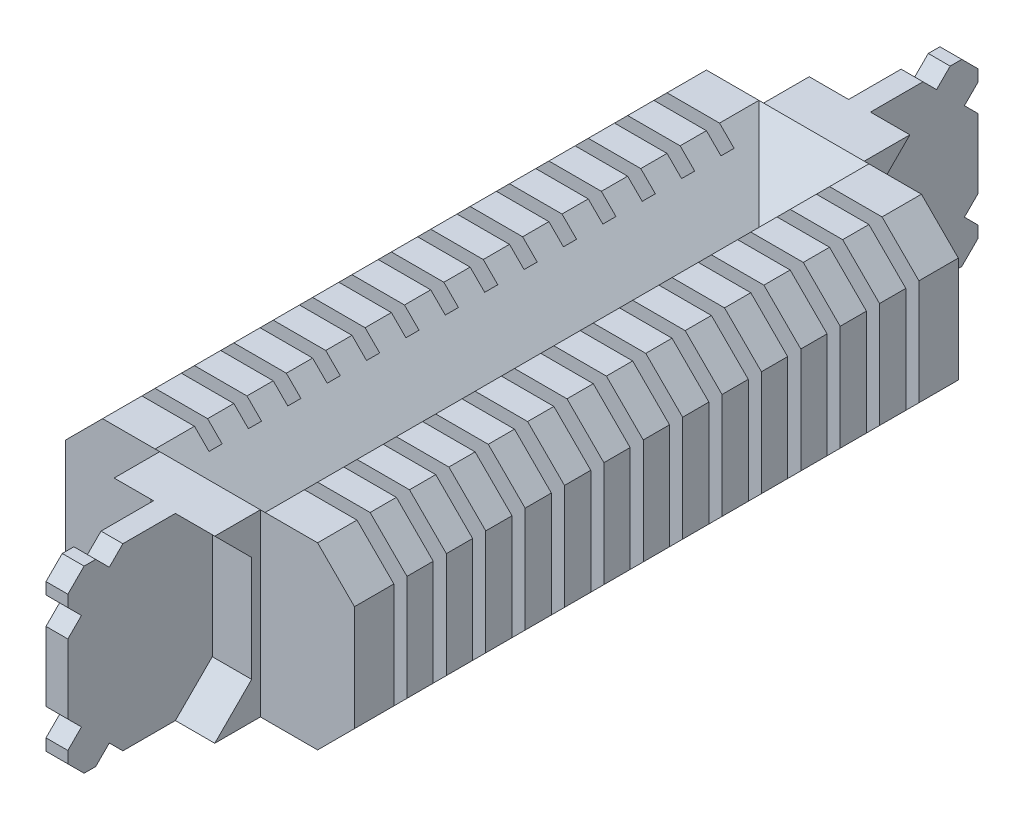
from build123d import *

# Parameters (mm, degrees)
AUFSATZ_LINEAR_AUSTRAGEN2_DEPTH      = 1.2
SCHNITT_LINEAR_AUSTRAGEN1_DEPTH      = 0.4
SCHNITT_LINEAR_AUSTRAGEN2_DEPTH      = 23.948638304
AUFSATZ_LINEAR_AUSTRAGEN3_DEPTH      = 1.2
SCHNITT_LINEAR_AUSTRAGEN3_DEPTH      = 24.198275798
LINEARES_MUSTER1_COUNT               = 15
LINEARES_MUSTER1_PITCH               = 3.6
LINEARES_MUSTER1_COPY_1_DEPTH        = 0.4
LINEARES_MUSTER1_COPY_2_DEPTH        = 0.4
LINEARES_MUSTER1_COPY_3_DEPTH        = 0.4
LINEARES_MUSTER1_COPY_4_DEPTH        = 0.4
LINEARES_MUSTER1_COPY_5_DEPTH        = 0.4
LINEARES_MUSTER1_COPY_6_DEPTH        = 0.4
LINEARES_MUSTER1_COPY_7_DEPTH        = 0.4
LINEARES_MUSTER1_COPY_8_DEPTH        = 0.4
LINEARES_MUSTER1_COPY_9_DEPTH        = 0.4
LINEARES_MUSTER1_COPY_10_DEPTH       = 0.4
LINEARES_MUSTER1_COPY_11_DEPTH       = 0.4
LINEARES_MUSTER1_COPY_12_DEPTH       = 0.4
LINEARES_MUSTER1_COPY_13_DEPTH       = 0.4
LINEARES_MUSTER1_COPY_14_DEPTH       = 0.4
LINEARES_MUSTER1_COPY_15_DEPTH       = 23.948638304
LINEARES_MUSTER1_COPY_16_DEPTH       = 23.948638304
LINEARES_MUSTER1_COPY_17_DEPTH       = 23.948638304
LINEARES_MUSTER1_COPY_18_DEPTH       = 23.948638304
LINEARES_MUSTER1_COPY_19_DEPTH       = 23.948638304
LINEARES_MUSTER1_COPY_20_DEPTH       = 23.948638304
LINEARES_MUSTER1_COPY_21_DEPTH       = 23.948638304
LINEARES_MUSTER1_COPY_22_DEPTH       = 23.948638304
LINEARES_MUSTER1_COPY_23_DEPTH       = 23.948638304
LINEARES_MUSTER1_COPY_24_DEPTH       = 23.948638304
LINEARES_MUSTER1_COPY_25_DEPTH       = 23.948638304
LINEARES_MUSTER1_COPY_26_DEPTH       = 23.948638304
LINEARES_MUSTER1_COPY_27_DEPTH       = 23.948638304
LINEARES_MUSTER1_COPY_28_DEPTH       = 23.948638304
LINEARES_MUSTER1_COPY_29_DEPTH       = 24.198275798
LINEARES_MUSTER1_COPY_30_DEPTH       = 24.198275798
LINEARES_MUSTER1_COPY_31_DEPTH       = 24.198275798
LINEARES_MUSTER1_COPY_32_DEPTH       = 24.198275798
LINEARES_MUSTER1_COPY_33_DEPTH       = 24.198275798
LINEARES_MUSTER1_COPY_34_DEPTH       = 24.198275798
LINEARES_MUSTER1_COPY_35_DEPTH       = 24.198275798
LINEARES_MUSTER1_COPY_36_DEPTH       = 24.198275798
LINEARES_MUSTER1_COPY_37_DEPTH       = 24.198275798
LINEARES_MUSTER1_COPY_38_DEPTH       = 24.198275798
LINEARES_MUSTER1_COPY_39_DEPTH       = 24.198275798
LINEARES_MUSTER1_COPY_40_DEPTH       = 24.198275798
LINEARES_MUSTER1_COPY_41_DEPTH       = 24.198275798
LINEARES_MUSTER1_COPY_42_DEPTH       = 24.198275798
AUFSATZ_LINEAR_AUSTRAGEN4_DEPTH      = 1.2
AUFSATZ_LINEAR_AUSTRAGEN4_DEPTH_BACK = 0.8
AUFSATZ_LINEAR_AUSTRAGEN5_DEPTH      = 1.2
AUFSATZ_LINEAR_AUSTRAGEN5_DEPTH_BACK = 0.8
AUFSATZ_LINEAR_AUSTRAGEN6_DEPTH      = 1
AUFSATZ_LINEAR_AUSTRAGEN7_DEPTH      = 3.6
SCHNITT_LINEAR_AUSTRAGEN4_DEPTH      = 0.902943725
SKIZZE14_W                           = 0.902943725
SKIZZE14_H                           = 0.428427125
SCHNITT_LINEAR_AUSTRAGEN5_DEPTH      = 72.226791416
SPIEGELN11_START                     = -12.8
SPIEGELN11_DEPTH                     = 3.6
SPIEGELN11_START_2                   = -10.091704
SPIEGELN11_2_DEPTH                   = 6.491704
AUFSATZ_LINEAR_AUSTRAGEN8_DEPTH      = 1
SCHNITT_LINEAR_AUSTRAGEN6_DEPTH      = 69.783137468


with BuildPart() as part:
    # Skizze3 → Aufsatz-Linear austragen2 (new, symmetric)
    with BuildSketch(Plane.XY):
        Polygon((-8.2, 3.171572875), (-3.171572875, 8.2), (1.628427125, 8.2), (5, 4.828427125), (5, -4.828427125), (1.628427125, -8.2), (-3.171572875, -8.2), (-8.2, -3.171572875), (-13.228427125, -8.2), (-18.028427125, -8.2), (-21.4, -4.828427125), (-21.4, 4.828427125), (-18.028427125, 8.2), (-13.228427125, 8.2), align=None)
    aufsatz_linear_austragen2 = extrude(amount=AUFSATZ_LINEAR_AUSTRAGEN2_DEPTH, both=True)

    # Skizze2 → Schnitt-Linear austragen1 (cut, symmetric)
    with BuildSketch(Plane.XY):
        Polygon((-7, 0), (0, 7), (3, 4), (3, -4), (0, -7), align=None)
    schnitt_linear_austragen1 = extrude(amount=SCHNITT_LINEAR_AUSTRAGEN1_DEPTH, both=True, mode=Mode.SUBTRACT)

    # Spiegeln2: Schnitt-Linear austragen1 across plane
    add(schnitt_linear_austragen1.mirror(Plane(origin=(-8.2, 0, 0), x_dir=(0, 0, 1), z_dir=(1, 0, 0))), mode=Mode.SUBTRACT)

    # Skizze5 → Schnitt-Linear austragen2 (cut, symmetric)
    with BuildSketch(Plane.XY):
        Polygon((-7, 0), (-6.151471863, 0.848528137), (-5.302943725, 0), (-6.151471863, -0.848528137), align=None)
    schnitt_linear_austragen2 = extrude(amount=SCHNITT_LINEAR_AUSTRAGEN2_DEPTH, both=True, mode=Mode.SUBTRACT)

    # Spiegeln3: Schnitt-Linear austragen2 across plane
    add(schnitt_linear_austragen2.mirror(Plane(origin=(-8.2, 0, 0), x_dir=(0, 0, 1), z_dir=(1, 0, 0))), mode=Mode.SUBTRACT)

    # Skizze6 → Aufsatz-Linear austragen3 (add)
    with BuildSketch(Plane.XY.offset(1.2)):
        Polygon((-4.502943725, 6.86862915), (-8.2, 3.171572875), (-11.897056275, 6.86862915), (-11.897056275, -6.86862915), (-8.2, -3.171572875), (-4.502943725, -6.86862915), align=None)
    aufsatz_linear_austragen3 = extrude(amount=AUFSATZ_LINEAR_AUSTRAGEN3_DEPTH)

    # Skizze7 → Schnitt-Linear austragen3 (cut, through all)
    with BuildSketch(Plane(origin=(0, 0, -1.2), x_dir=(-1, 0, 0), z_dir=(0, 0, -1))):
        Polygon((6.151471863, -0.848528137), (7, 0), (6.151471863, 0.848528137), (5.302943725, 0), align=None)
    schnitt_linear_austragen3 = extrude(amount=-SCHNITT_LINEAR_AUSTRAGEN3_DEPTH, mode=Mode.SUBTRACT)

    # Spiegeln4: Schnitt-Linear austragen3 across plane
    add(schnitt_linear_austragen3.mirror(Plane(origin=(-8.2, 0, 0), x_dir=(0, 0, 1), z_dir=(1, 0, 0))), mode=Mode.SUBTRACT)

    # Lineares Muster1: Aufsatz-Linear austragen2, Schnitt-Linear austragen1, Schnitt-Linear austragen2, Aufsatz-Linear austragen3, Schnitt-Linear austragen3 ×15
    with Locations(*[(0, 0, i * LINEARES_MUSTER1_PITCH) for i in range(1, LINEARES_MUSTER1_COUNT)]):
        add(aufsatz_linear_austragen2)
        add(schnitt_linear_austragen1, mode=Mode.SUBTRACT)
        add(schnitt_linear_austragen2, mode=Mode.SUBTRACT)
        add(aufsatz_linear_austragen3)
        add(schnitt_linear_austragen3, mode=Mode.SUBTRACT)

    # Lineares Muster1 copy 1 sketch → Lineares Muster1 copy 1 (cut, symmetric)
    with BuildSketch(Plane(origin=(-16.4, 0, 3.6), x_dir=(-1, 0, 0), z_dir=(0, 0, 1))):
        Polygon((-7, 0), (0, -7), (3, -4), (3, 4), (0, 7), align=None)
    extrude(amount=LINEARES_MUSTER1_COPY_1_DEPTH, both=True, mode=Mode.SUBTRACT)

    # Lineares Muster1 copy 2 sketch → Lineares Muster1 copy 2 (cut, symmetric)
    with BuildSketch(Plane(origin=(-16.4, 0, 7.2), x_dir=(-1, 0, 0), z_dir=(0, 0, 1))):
        Polygon((-7, 0), (0, -7), (3, -4), (3, 4), (0, 7), align=None)
    extrude(amount=LINEARES_MUSTER1_COPY_2_DEPTH, both=True, mode=Mode.SUBTRACT)

    # Lineares Muster1 copy 3 sketch → Lineares Muster1 copy 3 (cut, symmetric)
    with BuildSketch(Plane(origin=(-16.4, 0, 10.8), x_dir=(-1, 0, 0), z_dir=(0, 0, 1))):
        Polygon((-7, 0), (0, -7), (3, -4), (3, 4), (0, 7), align=None)
    extrude(amount=LINEARES_MUSTER1_COPY_3_DEPTH, both=True, mode=Mode.SUBTRACT)

    # Lineares Muster1 copy 4 sketch → Lineares Muster1 copy 4 (cut, symmetric)
    with BuildSketch(Plane(origin=(-16.4, 0, 14.4), x_dir=(-1, 0, 0), z_dir=(0, 0, 1))):
        Polygon((-7, 0), (0, -7), (3, -4), (3, 4), (0, 7), align=None)
    extrude(amount=LINEARES_MUSTER1_COPY_4_DEPTH, both=True, mode=Mode.SUBTRACT)

    # Lineares Muster1 copy 5 sketch → Lineares Muster1 copy 5 (cut, symmetric)
    with BuildSketch(Plane(origin=(-16.4, 0, 18), x_dir=(-1, 0, 0), z_dir=(0, 0, 1))):
        Polygon((-7, 0), (0, -7), (3, -4), (3, 4), (0, 7), align=None)
    extrude(amount=LINEARES_MUSTER1_COPY_5_DEPTH, both=True, mode=Mode.SUBTRACT)

    # Lineares Muster1 copy 6 sketch → Lineares Muster1 copy 6 (cut, symmetric)
    with BuildSketch(Plane(origin=(-16.4, 0, 21.6), x_dir=(-1, 0, 0), z_dir=(0, 0, 1))):
        Polygon((-7, 0), (0, -7), (3, -4), (3, 4), (0, 7), align=None)
    extrude(amount=LINEARES_MUSTER1_COPY_6_DEPTH, both=True, mode=Mode.SUBTRACT)

    # Lineares Muster1 copy 7 sketch → Lineares Muster1 copy 7 (cut, symmetric)
    with BuildSketch(Plane(origin=(-16.4, 0, 25.2), x_dir=(-1, 0, 0), z_dir=(0, 0, 1))):
        Polygon((-7, 0), (0, -7), (3, -4), (3, 4), (0, 7), align=None)
    extrude(amount=LINEARES_MUSTER1_COPY_7_DEPTH, both=True, mode=Mode.SUBTRACT)

    # Lineares Muster1 copy 8 sketch → Lineares Muster1 copy 8 (cut, symmetric)
    with BuildSketch(Plane(origin=(-16.4, 0, 28.8), x_dir=(-1, 0, 0), z_dir=(0, 0, 1))):
        Polygon((-7, 0), (0, -7), (3, -4), (3, 4), (0, 7), align=None)
    extrude(amount=LINEARES_MUSTER1_COPY_8_DEPTH, both=True, mode=Mode.SUBTRACT)

    # Lineares Muster1 copy 9 sketch → Lineares Muster1 copy 9 (cut, symmetric)
    with BuildSketch(Plane(origin=(-16.4, 0, 32.4), x_dir=(-1, 0, 0), z_dir=(0, 0, 1))):
        Polygon((-7, 0), (0, -7), (3, -4), (3, 4), (0, 7), align=None)
    extrude(amount=LINEARES_MUSTER1_COPY_9_DEPTH, both=True, mode=Mode.SUBTRACT)

    # Lineares Muster1 copy 10 sketch → Lineares Muster1 copy 10 (cut, symmetric)
    with BuildSketch(Plane(origin=(-16.4, 0, 36), x_dir=(-1, 0, 0), z_dir=(0, 0, 1))):
        Polygon((-7, 0), (0, -7), (3, -4), (3, 4), (0, 7), align=None)
    extrude(amount=LINEARES_MUSTER1_COPY_10_DEPTH, both=True, mode=Mode.SUBTRACT)

    # Lineares Muster1 copy 11 sketch → Lineares Muster1 copy 11 (cut, symmetric)
    with BuildSketch(Plane(origin=(-16.4, 0, 39.6), x_dir=(-1, 0, 0), z_dir=(0, 0, 1))):
        Polygon((-7, 0), (0, -7), (3, -4), (3, 4), (0, 7), align=None)
    extrude(amount=LINEARES_MUSTER1_COPY_11_DEPTH, both=True, mode=Mode.SUBTRACT)

    # Lineares Muster1 copy 12 sketch → Lineares Muster1 copy 12 (cut, symmetric)
    with BuildSketch(Plane(origin=(-16.4, 0, 43.2), x_dir=(-1, 0, 0), z_dir=(0, 0, 1))):
        Polygon((-7, 0), (0, -7), (3, -4), (3, 4), (0, 7), align=None)
    extrude(amount=LINEARES_MUSTER1_COPY_12_DEPTH, both=True, mode=Mode.SUBTRACT)

    # Lineares Muster1 copy 13 sketch → Lineares Muster1 copy 13 (cut, symmetric)
    with BuildSketch(Plane(origin=(-16.4, 0, 46.8), x_dir=(-1, 0, 0), z_dir=(0, 0, 1))):
        Polygon((-7, 0), (0, -7), (3, -4), (3, 4), (0, 7), align=None)
    extrude(amount=LINEARES_MUSTER1_COPY_13_DEPTH, both=True, mode=Mode.SUBTRACT)

    # Lineares Muster1 copy 14 sketch → Lineares Muster1 copy 14 (cut, symmetric)
    with BuildSketch(Plane(origin=(-16.4, 0, 50.4), x_dir=(-1, 0, 0), z_dir=(0, 0, 1))):
        Polygon((-7, 0), (0, -7), (3, -4), (3, 4), (0, 7), align=None)
    extrude(amount=LINEARES_MUSTER1_COPY_14_DEPTH, both=True, mode=Mode.SUBTRACT)

    # Lineares Muster1 copy 15 sketch → Lineares Muster1 copy 15 (cut, symmetric)
    with BuildSketch(Plane(origin=(-16.4, 0, 3.6), x_dir=(-1, 0, 0), z_dir=(0, 0, 1))):
        Polygon((-7, 0), (-6.151471863, -0.848528137), (-5.302943725, 0), (-6.151471863, 0.848528137), align=None)
    extrude(amount=LINEARES_MUSTER1_COPY_15_DEPTH, both=True, mode=Mode.SUBTRACT)

    # Lineares Muster1 copy 16 sketch → Lineares Muster1 copy 16 (cut, symmetric)
    with BuildSketch(Plane(origin=(-16.4, 0, 7.2), x_dir=(-1, 0, 0), z_dir=(0, 0, 1))):
        Polygon((-7, 0), (-6.151471863, -0.848528137), (-5.302943725, 0), (-6.151471863, 0.848528137), align=None)
    extrude(amount=LINEARES_MUSTER1_COPY_16_DEPTH, both=True, mode=Mode.SUBTRACT)

    # Lineares Muster1 copy 17 sketch → Lineares Muster1 copy 17 (cut, symmetric)
    with BuildSketch(Plane(origin=(-16.4, 0, 10.8), x_dir=(-1, 0, 0), z_dir=(0, 0, 1))):
        Polygon((-7, 0), (-6.151471863, -0.848528137), (-5.302943725, 0), (-6.151471863, 0.848528137), align=None)
    extrude(amount=LINEARES_MUSTER1_COPY_17_DEPTH, both=True, mode=Mode.SUBTRACT)

    # Lineares Muster1 copy 18 sketch → Lineares Muster1 copy 18 (cut, symmetric)
    with BuildSketch(Plane(origin=(-16.4, 0, 14.4), x_dir=(-1, 0, 0), z_dir=(0, 0, 1))):
        Polygon((-7, 0), (-6.151471863, -0.848528137), (-5.302943725, 0), (-6.151471863, 0.848528137), align=None)
    extrude(amount=LINEARES_MUSTER1_COPY_18_DEPTH, both=True, mode=Mode.SUBTRACT)

    # Lineares Muster1 copy 19 sketch → Lineares Muster1 copy 19 (cut, symmetric)
    with BuildSketch(Plane(origin=(-16.4, 0, 18), x_dir=(-1, 0, 0), z_dir=(0, 0, 1))):
        Polygon((-7, 0), (-6.151471863, -0.848528137), (-5.302943725, 0), (-6.151471863, 0.848528137), align=None)
    extrude(amount=LINEARES_MUSTER1_COPY_19_DEPTH, both=True, mode=Mode.SUBTRACT)

    # Lineares Muster1 copy 20 sketch → Lineares Muster1 copy 20 (cut, symmetric)
    with BuildSketch(Plane(origin=(-16.4, 0, 21.6), x_dir=(-1, 0, 0), z_dir=(0, 0, 1))):
        Polygon((-7, 0), (-6.151471863, -0.848528137), (-5.302943725, 0), (-6.151471863, 0.848528137), align=None)
    extrude(amount=LINEARES_MUSTER1_COPY_20_DEPTH, both=True, mode=Mode.SUBTRACT)

    # Lineares Muster1 copy 21 sketch → Lineares Muster1 copy 21 (cut, symmetric)
    with BuildSketch(Plane(origin=(-16.4, 0, 25.2), x_dir=(-1, 0, 0), z_dir=(0, 0, 1))):
        Polygon((-7, 0), (-6.151471863, -0.848528137), (-5.302943725, 0), (-6.151471863, 0.848528137), align=None)
    extrude(amount=LINEARES_MUSTER1_COPY_21_DEPTH, both=True, mode=Mode.SUBTRACT)

    # Lineares Muster1 copy 22 sketch → Lineares Muster1 copy 22 (cut, symmetric)
    with BuildSketch(Plane(origin=(-16.4, 0, 28.8), x_dir=(-1, 0, 0), z_dir=(0, 0, 1))):
        Polygon((-7, 0), (-6.151471863, -0.848528137), (-5.302943725, 0), (-6.151471863, 0.848528137), align=None)
    extrude(amount=LINEARES_MUSTER1_COPY_22_DEPTH, both=True, mode=Mode.SUBTRACT)

    # Lineares Muster1 copy 23 sketch → Lineares Muster1 copy 23 (cut, symmetric)
    with BuildSketch(Plane(origin=(-16.4, 0, 32.4), x_dir=(-1, 0, 0), z_dir=(0, 0, 1))):
        Polygon((-7, 0), (-6.151471863, -0.848528137), (-5.302943725, 0), (-6.151471863, 0.848528137), align=None)
    extrude(amount=LINEARES_MUSTER1_COPY_23_DEPTH, both=True, mode=Mode.SUBTRACT)

    # Lineares Muster1 copy 24 sketch → Lineares Muster1 copy 24 (cut, symmetric)
    with BuildSketch(Plane(origin=(-16.4, 0, 36), x_dir=(-1, 0, 0), z_dir=(0, 0, 1))):
        Polygon((-7, 0), (-6.151471863, -0.848528137), (-5.302943725, 0), (-6.151471863, 0.848528137), align=None)
    extrude(amount=LINEARES_MUSTER1_COPY_24_DEPTH, both=True, mode=Mode.SUBTRACT)

    # Lineares Muster1 copy 25 sketch → Lineares Muster1 copy 25 (cut, symmetric)
    with BuildSketch(Plane(origin=(-16.4, 0, 39.6), x_dir=(-1, 0, 0), z_dir=(0, 0, 1))):
        Polygon((-7, 0), (-6.151471863, -0.848528137), (-5.302943725, 0), (-6.151471863, 0.848528137), align=None)
    extrude(amount=LINEARES_MUSTER1_COPY_25_DEPTH, both=True, mode=Mode.SUBTRACT)

    # Lineares Muster1 copy 26 sketch → Lineares Muster1 copy 26 (cut, symmetric)
    with BuildSketch(Plane(origin=(-16.4, 0, 43.2), x_dir=(-1, 0, 0), z_dir=(0, 0, 1))):
        Polygon((-7, 0), (-6.151471863, -0.848528137), (-5.302943725, 0), (-6.151471863, 0.848528137), align=None)
    extrude(amount=LINEARES_MUSTER1_COPY_26_DEPTH, both=True, mode=Mode.SUBTRACT)

    # Lineares Muster1 copy 27 sketch → Lineares Muster1 copy 27 (cut, symmetric)
    with BuildSketch(Plane(origin=(-16.4, 0, 46.8), x_dir=(-1, 0, 0), z_dir=(0, 0, 1))):
        Polygon((-7, 0), (-6.151471863, -0.848528137), (-5.302943725, 0), (-6.151471863, 0.848528137), align=None)
    extrude(amount=LINEARES_MUSTER1_COPY_27_DEPTH, both=True, mode=Mode.SUBTRACT)

    # Lineares Muster1 copy 28 sketch → Lineares Muster1 copy 28 (cut, symmetric)
    with BuildSketch(Plane(origin=(-16.4, 0, 50.4), x_dir=(-1, 0, 0), z_dir=(0, 0, 1))):
        Polygon((-7, 0), (-6.151471863, -0.848528137), (-5.302943725, 0), (-6.151471863, 0.848528137), align=None)
    extrude(amount=LINEARES_MUSTER1_COPY_28_DEPTH, both=True, mode=Mode.SUBTRACT)

    # Lineares Muster1 copy 29 sketch → Lineares Muster1 copy 29 (cut, through all)
    with BuildSketch(Plane(origin=(-16.4, 0, 2.4), x_dir=(1, 0, 0), z_dir=(0, 0, -1))):
        Polygon((6.151471863, 0.848528137), (7, 0), (6.151471863, -0.848528137), (5.302943725, 0), align=None)
    extrude(amount=-LINEARES_MUSTER1_COPY_29_DEPTH, mode=Mode.SUBTRACT)

    # Lineares Muster1 copy 30 sketch → Lineares Muster1 copy 30 (cut, through all)
    with BuildSketch(Plane(origin=(-16.4, 0, 6), x_dir=(1, 0, 0), z_dir=(0, 0, -1))):
        Polygon((6.151471863, 0.848528137), (7, 0), (6.151471863, -0.848528137), (5.302943725, 0), align=None)
    extrude(amount=-LINEARES_MUSTER1_COPY_30_DEPTH, mode=Mode.SUBTRACT)

    # Lineares Muster1 copy 31 sketch → Lineares Muster1 copy 31 (cut, through all)
    with BuildSketch(Plane(origin=(-16.4, 0, 9.6), x_dir=(1, 0, 0), z_dir=(0, 0, -1))):
        Polygon((6.151471863, 0.848528137), (7, 0), (6.151471863, -0.848528137), (5.302943725, 0), align=None)
    extrude(amount=-LINEARES_MUSTER1_COPY_31_DEPTH, mode=Mode.SUBTRACT)

    # Lineares Muster1 copy 32 sketch → Lineares Muster1 copy 32 (cut, through all)
    with BuildSketch(Plane(origin=(-16.4, 0, 13.2), x_dir=(1, 0, 0), z_dir=(0, 0, -1))):
        Polygon((6.151471863, 0.848528137), (7, 0), (6.151471863, -0.848528137), (5.302943725, 0), align=None)
    extrude(amount=-LINEARES_MUSTER1_COPY_32_DEPTH, mode=Mode.SUBTRACT)

    # Lineares Muster1 copy 33 sketch → Lineares Muster1 copy 33 (cut, through all)
    with BuildSketch(Plane(origin=(-16.4, 0, 16.8), x_dir=(1, 0, 0), z_dir=(0, 0, -1))):
        Polygon((6.151471863, 0.848528137), (7, 0), (6.151471863, -0.848528137), (5.302943725, 0), align=None)
    extrude(amount=-LINEARES_MUSTER1_COPY_33_DEPTH, mode=Mode.SUBTRACT)

    # Lineares Muster1 copy 34 sketch → Lineares Muster1 copy 34 (cut, through all)
    with BuildSketch(Plane(origin=(-16.4, 0, 20.4), x_dir=(1, 0, 0), z_dir=(0, 0, -1))):
        Polygon((6.151471863, 0.848528137), (7, 0), (6.151471863, -0.848528137), (5.302943725, 0), align=None)
    extrude(amount=-LINEARES_MUSTER1_COPY_34_DEPTH, mode=Mode.SUBTRACT)

    # Lineares Muster1 copy 35 sketch → Lineares Muster1 copy 35 (cut, through all)
    with BuildSketch(Plane(origin=(-16.4, 0, 24), x_dir=(1, 0, 0), z_dir=(0, 0, -1))):
        Polygon((6.151471863, 0.848528137), (7, 0), (6.151471863, -0.848528137), (5.302943725, 0), align=None)
    extrude(amount=-LINEARES_MUSTER1_COPY_35_DEPTH, mode=Mode.SUBTRACT)

    # Lineares Muster1 copy 36 sketch → Lineares Muster1 copy 36 (cut, through all)
    with BuildSketch(Plane(origin=(-16.4, 0, 27.6), x_dir=(1, 0, 0), z_dir=(0, 0, -1))):
        Polygon((6.151471863, 0.848528137), (7, 0), (6.151471863, -0.848528137), (5.302943725, 0), align=None)
    extrude(amount=-LINEARES_MUSTER1_COPY_36_DEPTH, mode=Mode.SUBTRACT)

    # Lineares Muster1 copy 37 sketch → Lineares Muster1 copy 37 (cut, through all)
    with BuildSketch(Plane(origin=(-16.4, 0, 31.2), x_dir=(1, 0, 0), z_dir=(0, 0, -1))):
        Polygon((6.151471863, 0.848528137), (7, 0), (6.151471863, -0.848528137), (5.302943725, 0), align=None)
    extrude(amount=-LINEARES_MUSTER1_COPY_37_DEPTH, mode=Mode.SUBTRACT)

    # Lineares Muster1 copy 38 sketch → Lineares Muster1 copy 38 (cut, through all)
    with BuildSketch(Plane(origin=(-16.4, 0, 34.8), x_dir=(1, 0, 0), z_dir=(0, 0, -1))):
        Polygon((6.151471863, 0.848528137), (7, 0), (6.151471863, -0.848528137), (5.302943725, 0), align=None)
    extrude(amount=-LINEARES_MUSTER1_COPY_38_DEPTH, mode=Mode.SUBTRACT)

    # Lineares Muster1 copy 39 sketch → Lineares Muster1 copy 39 (cut, through all)
    with BuildSketch(Plane(origin=(-16.4, 0, 38.4), x_dir=(1, 0, 0), z_dir=(0, 0, -1))):
        Polygon((6.151471863, 0.848528137), (7, 0), (6.151471863, -0.848528137), (5.302943725, 0), align=None)
    extrude(amount=-LINEARES_MUSTER1_COPY_39_DEPTH, mode=Mode.SUBTRACT)

    # Lineares Muster1 copy 40 sketch → Lineares Muster1 copy 40 (cut, through all)
    with BuildSketch(Plane(origin=(-16.4, 0, 42), x_dir=(1, 0, 0), z_dir=(0, 0, -1))):
        Polygon((6.151471863, 0.848528137), (7, 0), (6.151471863, -0.848528137), (5.302943725, 0), align=None)
    extrude(amount=-LINEARES_MUSTER1_COPY_40_DEPTH, mode=Mode.SUBTRACT)

    # Lineares Muster1 copy 41 sketch → Lineares Muster1 copy 41 (cut, through all)
    with BuildSketch(Plane(origin=(-16.4, 0, 45.6), x_dir=(1, 0, 0), z_dir=(0, 0, -1))):
        Polygon((6.151471863, 0.848528137), (7, 0), (6.151471863, -0.848528137), (5.302943725, 0), align=None)
    extrude(amount=-LINEARES_MUSTER1_COPY_41_DEPTH, mode=Mode.SUBTRACT)

    # Lineares Muster1 copy 42 sketch → Lineares Muster1 copy 42 (cut, through all)
    with BuildSketch(Plane(origin=(-16.4, 0, 49.2), x_dir=(1, 0, 0), z_dir=(0, 0, -1))):
        Polygon((6.151471863, 0.848528137), (7, 0), (6.151471863, -0.848528137), (5.302943725, 0), align=None)
    extrude(amount=-LINEARES_MUSTER1_COPY_42_DEPTH, mode=Mode.SUBTRACT)

    # Skizze8 → Aufsatz-Linear austragen4 (add, two sides: drawn at the far end of the back side and taken through both)
    with BuildSketch(Plane(origin=(0, 0, -1.2), x_dir=(-1, 0, 0), z_dir=(0, 0, -1)).offset(-AUFSATZ_LINEAR_AUSTRAGEN4_DEPTH_BACK)):
        Polygon((3.171572875, -8.2), (8.2, -3.171572875), (13.228427125, -8.2), (18.028427125, -8.2), (21.4, -4.828427125), (21.4, 4.828427125), (18.028427125, 8.2), (13.228427125, 8.2), (8.2, 3.171572875), (3.171572875, 8.2), (-1.628427125, 8.2), (-5, 4.828427125), (-5, -4.828427125), (-1.628427125, -8.2), align=None)
    extrude(amount=AUFSATZ_LINEAR_AUSTRAGEN4_DEPTH + AUFSATZ_LINEAR_AUSTRAGEN4_DEPTH_BACK)

    # Skizze9 → Aufsatz-Linear austragen5 (add, two sides: drawn at the far end of the back side and taken through both)
    with BuildSketch(Plane.XY.offset(51.6).offset(-AUFSATZ_LINEAR_AUSTRAGEN5_DEPTH_BACK)):
        Polygon((-3.171572875, -8.2), (1.628427125, -8.2), (5, -4.828427125), (5, 4.828427125), (1.628427125, 8.2), (-3.171572875, 8.2), (-8.2, 3.171572875), (-13.228427125, 8.2), (-18.028427125, 8.2), (-21.4, 4.828427125), (-21.4, -4.828427125), (-18.028427125, -8.2), (-13.228427125, -8.2), (-8.2, -3.171572875), align=None)
    extrude(amount=AUFSATZ_LINEAR_AUSTRAGEN5_DEPTH + AUFSATZ_LINEAR_AUSTRAGEN5_DEPTH_BACK)

    # Skizze10 → Aufsatz-Linear austragen6 (add, symmetric)
    with BuildSketch(Plane(origin=(-8.2, 0, 0), x_dir=(0, 0, -1), z_dir=(1, 0, 0))):
        Polygon((-2.628427125, 3.171572875), (2.4, 8.2), (16.4, 8.2), (16.4, -8.2), (2.4, -8.2), (-2.628427125, -3.171572875), (2.4, -3.171572875), (2.4, 3.171572875), align=None)
    aufsatz_linear_austragen6 = extrude(amount=AUFSATZ_LINEAR_AUSTRAGEN6_DEPTH, both=True)

    # Spiegeln5: Aufsatz-Linear austragen6 across plane
    add(aufsatz_linear_austragen6.mirror(Plane.XY.offset(25.2)))

    # Skizze12 → Aufsatz-Linear austragen7 (add)
    with BuildSketch(Plane(origin=(-7.2, 0, 0), x_dir=(0, 0, -1), z_dir=(1, 0, 0))):
        Polygon((-1.628427125, 4.171572875), (2.4, 8.2), (6.571572875, 8.2), (3.2, 4.828427125), (3.2, -4.828427125), (6.571572875, -8.2), (2.4, -8.2), (-1.628427125, -4.171572875), (2.4, -4.171572875), (2.4, 4.171572875), align=None)
    aufsatz_linear_austragen7 = extrude(amount=AUFSATZ_LINEAR_AUSTRAGEN7_DEPTH)

    # Skizze13 → Schnitt-Linear austragen4 (cut)
    with BuildSketch(Plane(origin=(-3.6, 0, 0), x_dir=(0, 0, -1), z_dir=(1, 0, 0))):
        Polygon((-1.628427125, 4.171572875), (-1.2, 4.171572875), (-1.2, 4.6), align=None)
        Polygon((-1.628427125, -4.171572875), (-1.2, -4.6), (-1.2, -4.171572875), align=None)
    schnitt_linear_austragen4 = extrude(amount=-SCHNITT_LINEAR_AUSTRAGEN4_DEPTH, mode=Mode.SUBTRACT)

    # Spiegeln6: Aufsatz-Linear austragen7, Schnitt-Linear austragen4 across plane
    add(aufsatz_linear_austragen7.mirror(Plane.XY.offset(25.2)))
    add(schnitt_linear_austragen4.mirror(Plane.XY.offset(25.2)), mode=Mode.SUBTRACT)

    # Spiegeln10: Aufsatz-Linear austragen7 across plane
    add(aufsatz_linear_austragen7.mirror(Plane(origin=(-8.2, 0, 0), x_dir=(0, 0, 1), z_dir=(1, 0, 0))))

    # Skizze14 → Schnitt-Linear austragen5 (cut, symmetric)
    with BuildSketch(Plane(origin=(0, -4.171572875, 0), x_dir=(1, 0, 0), z_dir=(0, 1, 0))):
        with Locations((-12.348528138, -1.414213563)):
            Rectangle(SKIZZE14_W, SKIZZE14_H)
    extrude(amount=SCHNITT_LINEAR_AUSTRAGEN5_DEPTH, both=True, mode=Mode.SUBTRACT)

    # Spiegeln11: read off the stored shape, not the designer's step
    # Spiegeln11 outline → Spiegeln11 (add)
    with BuildSketch(Plane.YZ.offset(SPIEGELN11_START)):
        Polygon((4.171572875, 49.2), (4.6, 49.2), (8.2, 52.8), (8.2, 56.971572875), (4.828427125, 53.6), (-4.828427125, 53.6), (-8.2, 56.971572875), (-8.2, 52.8), (-4.6, 49.2), (-4.171572875, 49.2), (-4.171572875, 52.8), (4.171572875, 52.8), align=None)
    extrude(amount=SPIEGELN11_DEPTH)

    # Spiegeln11 2 outline → Spiegeln11 2 (add)
    with BuildSketch(Plane.YZ.offset(SPIEGELN11_START_2)):
        Polygon((4.171572875, 48.771572875), (4.6, 49.2), (4.171572875, 49.2), align=None)
        Polygon((-4.171572875, 48.771572875), (-4.171572875, 49.2), (-4.6, 49.2), align=None)
    extrude(amount=SPIEGELN11_2_DEPTH)

    # Skizze15 → Aufsatz-Linear austragen8 (add)
    with BuildSketch(Plane(origin=(-3.6, 0, 0), x_dir=(0, 0, -1), z_dir=(1, 0, 0))):
        Polygon((2.4, 8.2), (2.4, 7.771572875), (1.971572875, 7.771572875), align=None)
        Polygon((1.971572875, -7.771572875), (2.4, -8.2), (2.4, -7.771572875), align=None)
        Polygon((-52.8, -8.2), (-52.8, -7.771572875), (-52.371572875, -7.771572875), align=None)
        Polygon((-52.371572875, 7.771572875), (-52.8, 8.2), (-52.8, 7.771572875), align=None)
    aufsatz_linear_austragen8 = extrude(amount=AUFSATZ_LINEAR_AUSTRAGEN8_DEPTH)

    # Spiegeln12: Aufsatz-Linear austragen8 across plane
    add(aufsatz_linear_austragen8.mirror(Plane(origin=(-8.2, 0, 0), x_dir=(0, 0, 1), z_dir=(1, 0, 0))))

    # Skizze16 → Schnitt-Linear austragen6 (cut, through all)
    with BuildSketch(Plane(origin=(-7.2, 0, 0), x_dir=(0, 0, -1), z_dir=(1, 0, 0))):
        Polygon((16.4, 3.171572875), (15.158578644, 4.412994231), (16.4, 5.654415588), align=None)
        Polygon((16.4, 6.717157288), (14.917157288, 8.2), (16.4, 8.2), align=None)
        Polygon((13.854415588, 8.2), (12.612994231, 6.958578644), (11.371572875, 8.2), align=None)
        Polygon((16.4, -5.654415588), (16.4, -3.171572875), (15.158578644, -4.412994231), align=None)
        Polygon((16.4, -8.2), (16.4, -6.717157288), (14.917157288, -8.2), align=None)
        Polygon((13.854415588, -8.2), (12.612994231, -6.958578644), (11.371572875, -8.2), align=None)
        Polygon((-63.012994231, -6.958578644), (-61.771572875, -8.2), (-64.254415588, -8.2), align=None)
        Polygon((-66.8, -6.717157288), (-65.317157288, -8.2), (-66.8, -8.2), align=None)
        Polygon((-65.558578644, -4.412994231), (-66.8, -5.654415588), (-66.8, -3.171572875), align=None)
        Polygon((-66.8, 5.654415588), (-66.8, 3.171572875), (-65.558578644, 4.412994231), align=None)
        Polygon((-66.8, 8.2), (-66.8, 6.717157288), (-65.317157288, 8.2), align=None)
        Polygon((-64.254415588, 8.2), (-63.012994231, 6.958578644), (-61.771572875, 8.2), align=None)
    extrude(amount=-SCHNITT_LINEAR_AUSTRAGEN6_DEPTH, mode=Mode.SUBTRACT)


solid = part.part
